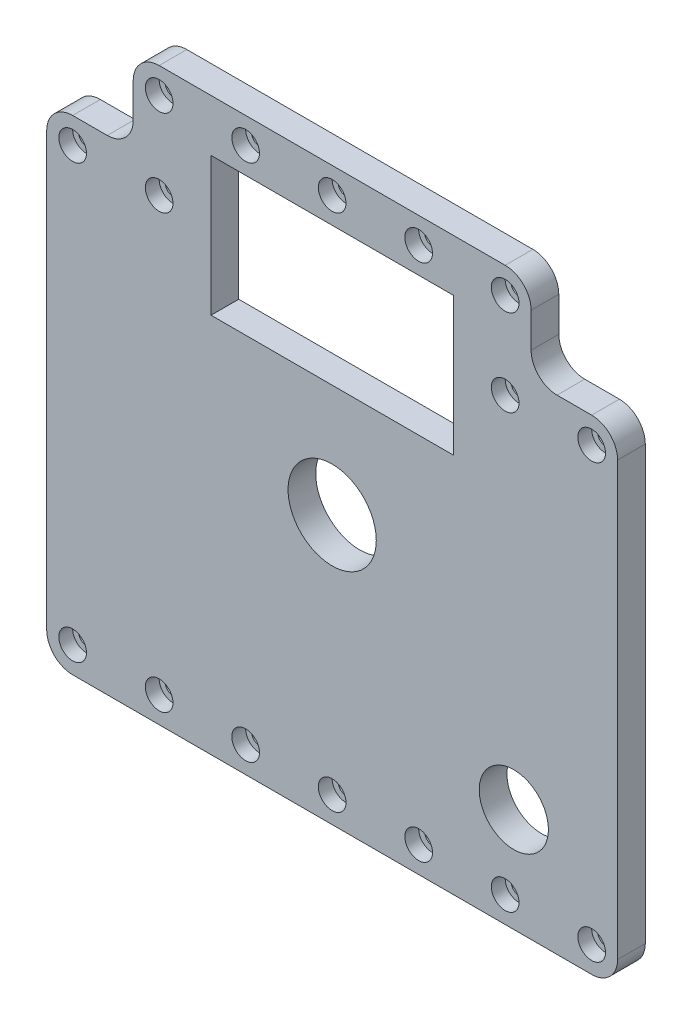
from build123d import *

# Parameters (mm, degrees)
SKETCH1_R                      = 10
SKETCH1_R_2                    = 12.75
SKETCH1_W                      = 70
SKETCH1_H                      = 40
BOSS_EXTRUDE1_DEPTH            = 8
CBORE_FOR_M4_SHCS1_D           = 4.5
CBORE_FOR_M4_SHCS1_CBORE_D     = 8
CBORE_FOR_M4_SHCS1_CBORE_DEPTH = 4


with BuildPart() as part:
    # Sketch1 → Boss-Extrude1 (new body)
    with BuildSketch(Plane.XY):
        with BuildLine():
            Line((-50, 67.5), (50, 67.5))
            ThreePointArc((50, 67.5), (55.303300859, 65.303300859), (57.5, 60))
            Line((57.5, 60), (57.5, 50))
            ThreePointArc((57.5, 50), (59.696699141, 44.696699141), (65, 42.5))
            Line((65, 42.5), (75, 42.5))
            ThreePointArc((75, 42.5), (80.303300859, 40.303300859), (82.5, 35))
            Line((82.5, 35), (82.5, -90))
            ThreePointArc((82.5, -90), (80.303300859, -95.303300859), (75, -97.5))
            Line((75, -97.5), (-75, -97.5))
            ThreePointArc((-75, -97.5), (-80.303300859, -95.303300859), (-82.5, -90))
            Line((-82.5, -90), (-82.5, 35))
            ThreePointArc((-82.5, 35), (-80.303300859, 40.303300859), (-75, 42.5))
            Line((-75, 42.5), (-65, 42.5))
            ThreePointArc((-65, 42.5), (-59.696699141, 44.696699141), (-57.5, 50))
            Line((-57.5, 50), (-57.5, 60))
            ThreePointArc((-57.5, 60), (-55.303300859, 65.303300859), (-50, 67.5))
        make_face()
        with Locations((52.5, -67.5)):
            Circle(SKETCH1_R, mode=Mode.SUBTRACT)
        with Locations((0, -20)):
            Circle(SKETCH1_R_2, mode=Mode.SUBTRACT)
        with Locations((0, 32.5)):
            Rectangle(SKETCH1_W, SKETCH1_H, mode=Mode.SUBTRACT)
    extrude(amount=-BOSS_EXTRUDE1_DEPTH)

    # CBORE for M4 SHCS1 (through all)
    with Locations(Plane.XY):
        with Locations((75, -90), (-25, 60), (-75, 35), (-50, 35), (-50, 60), (0, 60), (25, 60), (50, 60), (50, 35), (75, 35), (-25, -90), (-75, -90), (0, -90), (25, -90), (-50, -90), (50, -90)):
            CounterBoreHole(CBORE_FOR_M4_SHCS1_D / 2, CBORE_FOR_M4_SHCS1_CBORE_D / 2, CBORE_FOR_M4_SHCS1_CBORE_DEPTH)


solid = part.part
